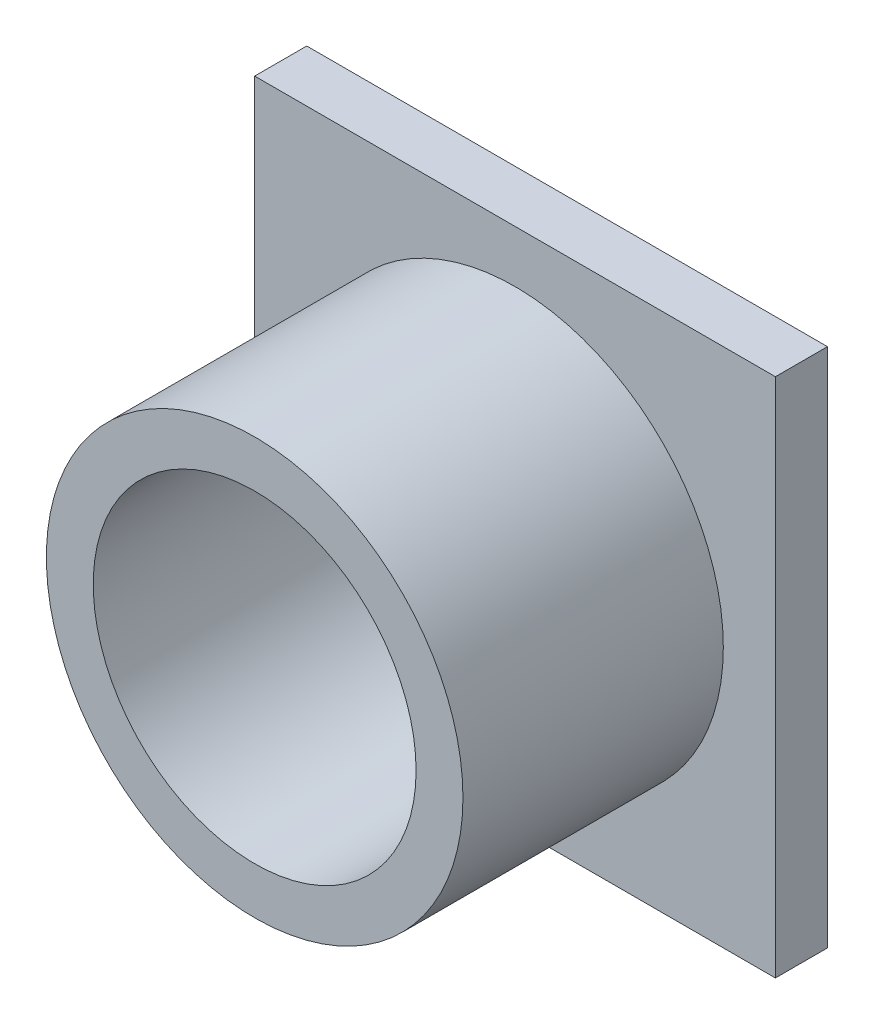
from build123d import *

# Parameters (mm, degrees)
SKETCH3_W           = 10
SKETCH3_H           = 10
BOSS_EXTRUDE1_DEPTH = 1
SKETCH4_R           = 4
BOSS_EXTRUDE2_DEPTH = 5
SKETCH5_R           = 3.1
CUT_EXTRUDE1_DEPTH  = 4.5


with BuildPart() as part:
    # Sketch3 → Boss-Extrude1 (new body)
    with BuildSketch(Plane.XY):
        Rectangle(SKETCH3_W, SKETCH3_H)
    extrude(amount=BOSS_EXTRUDE1_DEPTH)

    # Sketch4 → Boss-Extrude2 (add)
    with BuildSketch(Plane.XY.offset(1)):
        Circle(SKETCH4_R)
    extrude(amount=BOSS_EXTRUDE2_DEPTH)

    # Sketch5 → Cut-Extrude1 (cut)
    with BuildSketch(Plane.XY.offset(6)):
        Circle(SKETCH5_R)
    extrude(amount=-CUT_EXTRUDE1_DEPTH, mode=Mode.SUBTRACT)


solid = part.part
